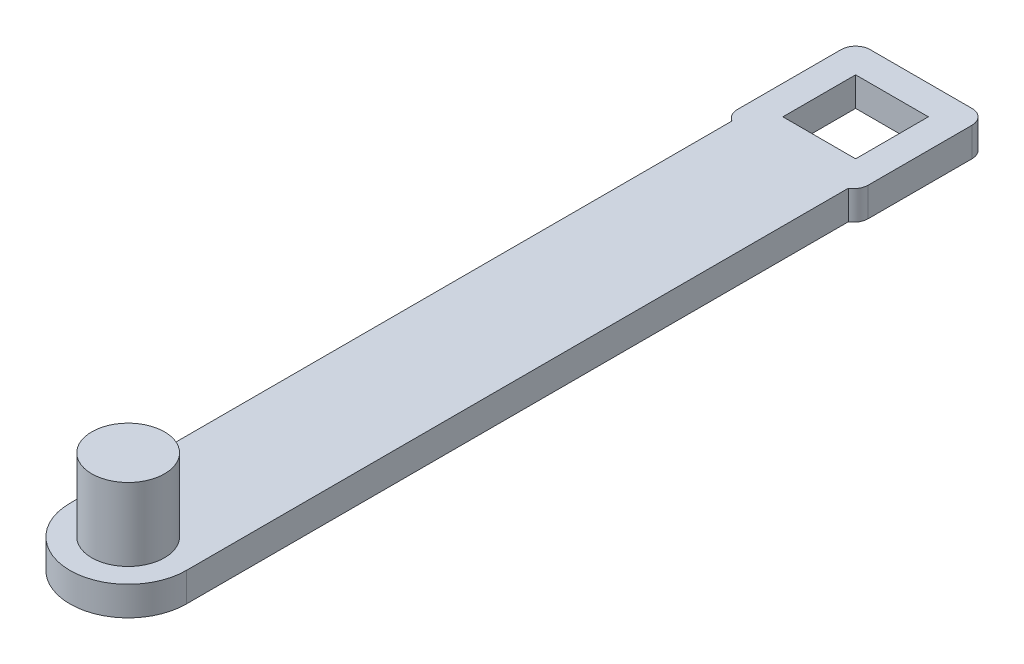
from build123d import *

# Parameters (mm, degrees)
SKETCH1_W           = 5
SKETCH1_H           = 5
BOSS_EXTRUDE1_DEPTH = 1
FILLET1_R           = 1
SKETCH2_R           = 2.5
BOSS_EXTRUDE2_DEPTH = 5


with BuildPart() as part:
    # Sketch1 → Boss-Extrude1 (new, symmetric)
    # profile 1 of 2: a face of its own
    with BuildSketch(Plane(origin=(0, 0, 0), x_dir=(1, 0, 0), z_dir=(0, 1, 0))):
        with BuildLine():
            Line((1.844736842, 5.044736842), (-6.155263158, 5.044736842))
            Line((-6.155263158, 5.044736842), (-6.155263158, -40.455263158))
            ThreePointArc((-6.155263158, -40.455263158), (-2.155263158, -44.455263158), (1.844736842, -40.455263158))
            Line((1.844736842, -40.455263158), (1.844736842, 5.044736842))
        make_face()
    # profile 2 of 2: a face of its own
    with BuildSketch(Plane(origin=(0, 0, 0), x_dir=(1, 0, 0), z_dir=(0, 1, 0))):
        Polygon((-6.655263158, 5.044736842), (-6.155263158, 5.044736842), (1.844736842, 5.044736842), (2.344736842, 5.044736842), (2.344736842, 14.044736842), (-6.655263158, 14.044736842), align=None)
        with Locations((-2.155263158, 9.544736842)):
            Rectangle(SKETCH1_W, SKETCH1_H, mode=Mode.SUBTRACT)
    extrude(amount=BOSS_EXTRUDE1_DEPTH, both=True)

    # Fillet1
    # the kernel refuses this fillet: 1 mm, written as the material it takes off along each edge
    with BuildSketch(Plane(origin=(2.344736842, 3.165063509, -5.044736842), x_dir=(0, 0, -1), z_dir=(0, -1, 0)), Plane(origin=(-6.655263158, -3.165063509, -5.044736842), x_dir=(0, 0, -1), z_dir=(0, 1, 0))) as fillet1_piece_1:
        with BuildLine():
            CenterArc((0.866025404, -1), FILLET1_R, 90, 60)
            Line((0, -0.5), (-0.017320508, -0.49))
            ThreePointArc((-0.017320508, -0.49), (-0.02, -0.25), (-0.02, 0))
            Line((-0.02, 0), (0, 0.02))
            Line((0, 0.02), (0.866025404, 0.02))
            Line((0.866025404, 0.02), (0.866025404, 0))
        make_face()
    extrude(amount=6.330127019, mode=Mode.SUBTRACT)
    with BuildSketch(Plane(origin=(2.344736842, 3.5, -14.044736842), x_dir=(-1, 0, 0), z_dir=(0, -1, 0)), Plane(origin=(-6.655263158, -3.5, -14.044736842), x_dir=(1, 0, 0), z_dir=(0, 1, 0))) as fillet1_piece_2:
        with BuildLine():
            CenterArc((FILLET1_R, -FILLET1_R), FILLET1_R, 90, 90)
            Line((0, -FILLET1_R), (-FILLET1_R * 0.02, -FILLET1_R))
            Line((-FILLET1_R * 0.02, -FILLET1_R), (-FILLET1_R * 0.02, FILLET1_R * 0.02))
            Line((-FILLET1_R * 0.02, FILLET1_R * 0.02), (FILLET1_R, FILLET1_R * 0.02))
            Line((FILLET1_R, FILLET1_R * 0.02), (FILLET1_R, 0))
        make_face()
    extrude(amount=7, mode=Mode.SUBTRACT)

    # Sketch2 → Boss-Extrude2 (add)
    with BuildSketch(Plane(origin=(0, 1, 0), x_dir=(1, 0, 0), z_dir=(0, 1, 0))):
        with Locations(Location((-2.155263158, -40.455263158, 0), (0, 0, 270))):
            Circle(SKETCH2_R)
    extrude(amount=BOSS_EXTRUDE2_DEPTH)


solid = part.part
